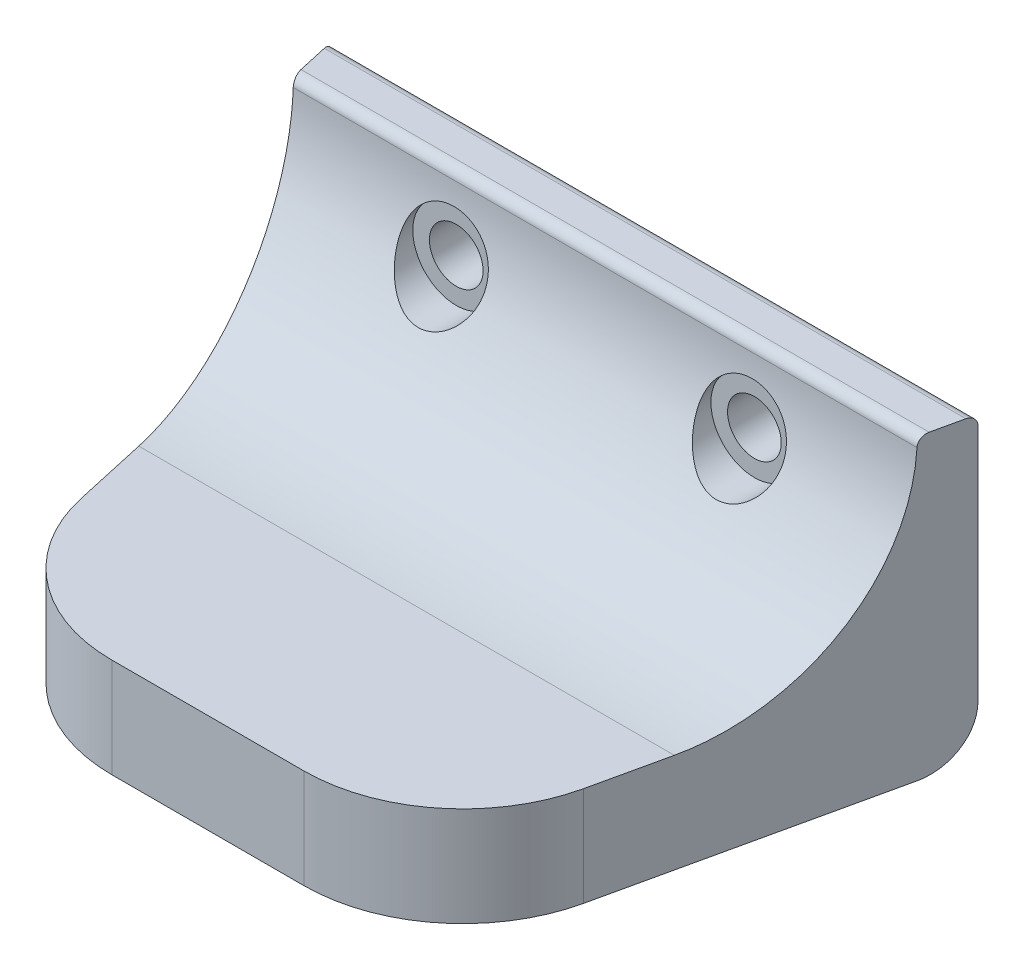
from build123d import *

# Parameters (mm, degrees)
BOSS_EXTRUDE1_DEPTH     = 12.7
BOSS_EXTRUDE2_DEPTH     = 38.1
FILLET1_R               = 25.4
FILLET2_R               = 20.32
FILLET3_R               = 6.35
FILLET4_R               = 1.2699999999999994
CUT_EXTRUDE5_REACH      = 82.133
CUT_EXTRUDE5_END_RADIUS = 25.400000000000002
SKETCH6_R               = 3.4289999999999985
CUT_EXTRUDE6_REACH      = 77.736
CUT_EXTRUDE6_END_RADIUS = 25.400000000000002
SKETCH7_R               = 5.55625
SKETCH7_R_2             = 5.556250000000004


with BuildPart() as part:
    # Sketch1 → Boss-Extrude1 (new body)
    with BuildSketch(Plane(origin=(0, 0, 0), x_dir=(1, 0, 0), z_dir=(0, 1, 0))):
        Polygon((39.86388888888888, 22.225000000000012), (-39.86388888888888, 22.225), (-28.574999999999996, -28.57499999999998), (28.575000000000006, -28.574999999999978), align=None)
        Polygon((41.27499999999999, 28.575000000000014), (-41.275000000000006, 28.575000000000003), (-39.863888888888894, 22.225), (39.86388888888888, 22.225000000000012), align=None)
    extrude(amount=BOSS_EXTRUDE1_DEPTH)

    # Sketch1<5> → Boss-Extrude2 (add)
    with BuildSketch(Plane(origin=(0, 0, 0), x_dir=(1, 0, 0), z_dir=(0, 1, 0))):
        Polygon((41.27499999999999, 28.575000000000014), (-41.275000000000006, 28.575000000000003), (-39.863888888888894, 22.225), (39.86388888888888, 22.225000000000012), align=None)
    extrude(amount=BOSS_EXTRUDE2_DEPTH)

    # Fillet1
    fillet1_edges = [part.edges().sort_by_distance(p)[0] for p in [
        (0, 12.7, -22.22500000000001),
    ]]
    fillet(fillet1_edges, radius=FILLET1_R - 0.0001)  # a hair under: the kernel refuses the full size

    # Fillet2
    fillet2_edges = [part.edges().sort_by_distance(p)[0] for p in [
        (28.575000000000006, 6.35, 28.574999999999978),
        (-28.574999999999996, 6.35, 28.57499999999998),
    ]]
    fillet(fillet2_edges, radius=FILLET2_R)

    # Fillet3
    fillet3_edges = [part.edges().sort_by_distance(p)[0] for p in [
        (-7.11e-15, 0, -28.57500000000001),
    ]]
    fillet(fillet3_edges, radius=FILLET3_R)

    # Fillet4
    fillet4_edges = [part.edges().sort_by_distance(p)[0] for p in [
        (0, 38.1, -22.22500000000001),
        (-7.11e-15, 38.1, -28.57500000000001),
    ]]
    fillet(fillet4_edges, radius=FILLET4_R)

    # Cut-Extrude5: up to this cylinder (the profile starts outside it)
    cut_extrude5_end = Plane(origin=(3.97e-15, 38.1, 3.1749999999999905), z_dir=(-1, 0, 1.3e-16)) * Cylinder(CUT_EXTRUDE5_END_RADIUS, 254.166, mode=Mode.PRIVATE)
    # Sketch6 → Cut-Extrude5 (cut, up to the surface)
    with BuildSketch(Plane(origin=(-3.6e-15, 0, -28.57500000000001), x_dir=(-1, 0, 1.3e-16), z_dir=(-1.3e-16, 0, -1)), mode=Mode.PRIVATE) as cut_extrude5_sk1:
        with Locations((-19.05, 28.701999999999998)):
            Circle(SKETCH6_R)
    cut_extrude5_tool1 = extrude(cut_extrude5_sk1.sketch, amount=-CUT_EXTRUDE5_REACH, mode=Mode.PRIVATE) - cut_extrude5_end
    add(cut_extrude5_tool1.solids().sort_by_distance((19.05, 28.702, -28.575))[0], mode=Mode.SUBTRACT)
    # Sketch6 → Cut-Extrude5 (cut, up to the surface)
    with BuildSketch(Plane(origin=(-3.6e-15, 0, -28.57500000000001), x_dir=(-1, 0, 1.3e-16), z_dir=(-1.3e-16, 0, -1)), mode=Mode.PRIVATE) as cut_extrude5_sk2:
        with Locations((19.05, 28.701999999999998)):
            Circle(SKETCH6_R)
    cut_extrude5_tool2 = extrude(cut_extrude5_sk2.sketch, amount=-CUT_EXTRUDE5_REACH, mode=Mode.PRIVATE) - cut_extrude5_end
    add(cut_extrude5_tool2.solids().sort_by_distance((-19.05, 28.702, -28.575))[0], mode=Mode.SUBTRACT)

    # Cut-Extrude6: up to this cylinder (the profile starts outside it)
    cut_extrude6_end = Plane(origin=(3.97e-15, 38.1, 3.1749999999999905), z_dir=(-1, 0, 1.3e-16)) * Cylinder(CUT_EXTRUDE6_END_RADIUS, 245.372, mode=Mode.PRIVATE)
    # Sketch7 → Cut-Extrude6 (cut, up to the surface)
    with BuildSketch(Plane(origin=(-2.8e-15, 0, -22.22500000000001), x_dir=(-1, 0, 1.3e-16), z_dir=(-1.3e-16, 0, -1)), mode=Mode.PRIVATE) as cut_extrude6_sk1:
        with Locations((-19.05, 28.701999999999998)):
            Circle(SKETCH7_R)
    cut_extrude6_tool1 = extrude(cut_extrude6_sk1.sketch, amount=-CUT_EXTRUDE6_REACH, mode=Mode.PRIVATE) - cut_extrude6_end
    add(cut_extrude6_tool1.solids().sort_by_distance((19.05, 28.702, -22.225))[0], mode=Mode.SUBTRACT)
    # Sketch7 → Cut-Extrude6 (cut, up to the surface)
    with BuildSketch(Plane(origin=(-2.8e-15, 0, -22.22500000000001), x_dir=(-1, 0, 1.3e-16), z_dir=(-1.3e-16, 0, -1)), mode=Mode.PRIVATE) as cut_extrude6_sk2:
        with Locations((19.05, 28.701999999999998)):
            Circle(SKETCH7_R_2)
    cut_extrude6_tool2 = extrude(cut_extrude6_sk2.sketch, amount=-CUT_EXTRUDE6_REACH, mode=Mode.PRIVATE) - cut_extrude6_end
    add(cut_extrude6_tool2.solids().sort_by_distance((-19.05, 28.702, -22.225))[0], mode=Mode.SUBTRACT)


solid = part.part
